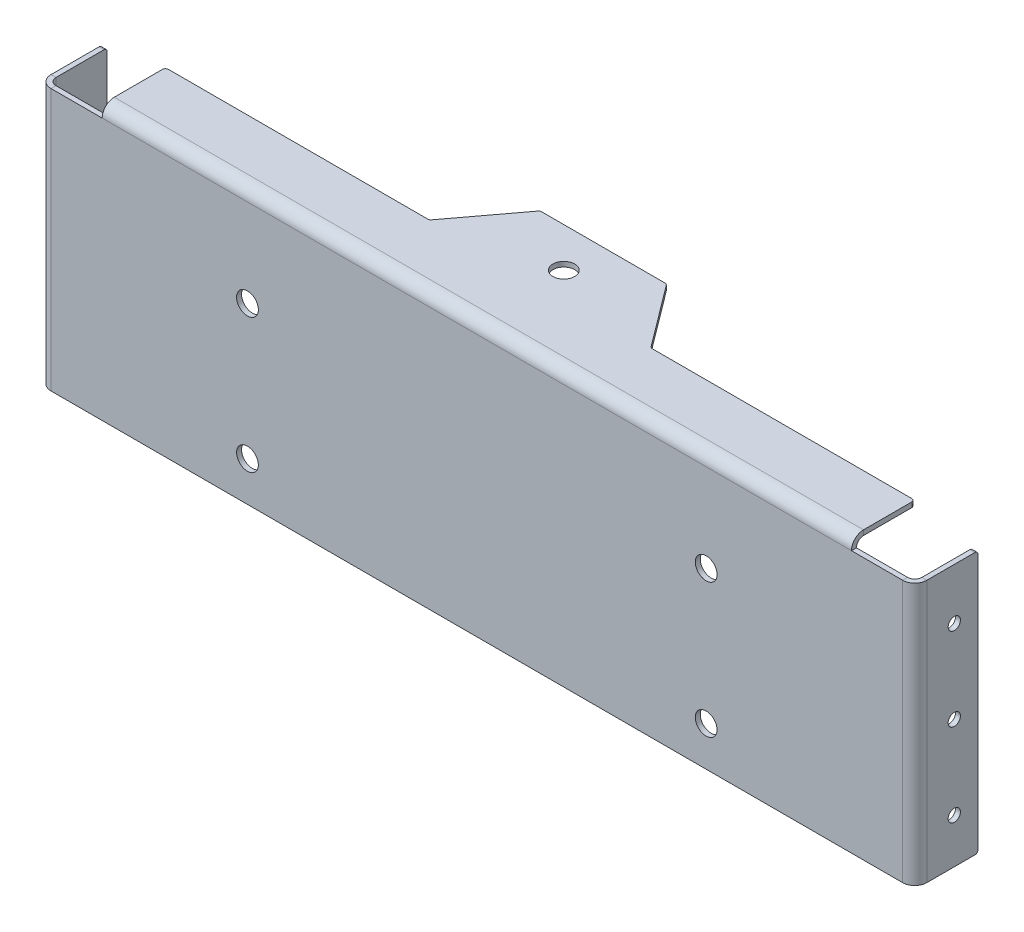
from build123d import *

# Parameters (mm, degrees)
SKETCH1_W                                 = 351.6122
SKETCH1_H                                 = 105.156
BASE_FLANGE1_DEPTH                        = 1.9939
EDGE_FLANGE1_STRIP_W                      = 13.66774
EDGE_FLANGE1_STRIP_H                      = 1.9939
EDGE_FLANGE1_STRIP_CUT_DEPTH              = 105.156
EDGE_FLANGE1_STRIP_2_W                    = 13.66774
EDGE_FLANGE1_STRIP_2_H                    = 1.9939
EDGE_FLANGE1_STRIP_CUT_2_DEPTH            = 105.156
EDGE_FLANGE1_DEPTH                        = 105.156
EDGE_FLANGE1_BEND_DEPTH                   = 105.156
EDGE_FLANGE2_DEPTH                        = 300.8122
EDGE_FLANGE2_START                        = 1.9939
EDGE_FLANGE2_FLAT_DEPTH                   = 1.9939
F_0_221_DIAMETER_HOLE1_D                  = 4.9149
HOLE_FOR_1_4_SELF_CLINCHING_NUTS_S_SS_C_D = 8.7376
HOLE_FOR_1_4_SELF_CLINCHING_NUTS_S_2_D    = 8.7376
FILLET1_R                                 = 1.27


# Sheet-metal steps are written as plain solids
with BuildPart() as part:
    # Sketch1 → Base-Flange1 (new body)
    with BuildSketch(Plane.XY):
        with Locations((175.8061, 52.578)):
            Rectangle(SKETCH1_W, SKETCH1_H)
    extrude(amount=-BASE_FLANGE1_DEPTH)

    # Edge-Flange1 strip (across the edge) → Edge-Flange1 strip cut (cut)
    with BuildSketch(Plane(origin=(0, 0, -1.9939), x_dir=(1, 0, 0), z_dir=(0, 1, 0))):
        with Locations((-1.9939, -0.99695)):
            Rectangle(EDGE_FLANGE1_STRIP_W, EDGE_FLANGE1_STRIP_H)
    extrude(amount=EDGE_FLANGE1_STRIP_CUT_DEPTH, mode=Mode.SUBTRACT)

    # Edge-Flange1 strip 2 (across the edge) → Edge-Flange1 strip cut 2 (cut)
    with BuildSketch(Plane(origin=(351.6122, 105.156, -1.9939), x_dir=(-1, 0, 0), z_dir=(0, -1, 0))):
        with Locations((-1.9939, -0.99695)):
            Rectangle(EDGE_FLANGE1_STRIP_2_W, EDGE_FLANGE1_STRIP_2_H)
    extrude(amount=EDGE_FLANGE1_STRIP_CUT_2_DEPTH, mode=Mode.SUBTRACT)

    # Edge-Flange1 section (across the edge) → Edge-Flange1 (add)
    with BuildSketch(Plane(origin=(0, 0, -1.9939), x_dir=(1, 0, 0), z_dir=(0, 1, 0))):
        with BuildLine():
            Line((0, 2.84607), (0, 23.4061))
            Line((0, 23.4061), (1.9939, 23.4061))
            Line((1.9939, 23.4061), (1.9939, 2.84607))
            ThreePointArc((1.9939, 2.84607), (2.827494603, 0.833594603), (4.83997, 0))
            Line((4.83997, 0), (4.83997, -1.9939))
            ThreePointArc((4.83997, -1.9939), (1.417594392, -0.576305608), (0, 2.84607))
        make_face()
    extrude(amount=EDGE_FLANGE1_DEPTH)

    # Edge-Flange1 section 2 (across the edge) → Edge-Flange1 bend (add)
    with BuildSketch(Plane(origin=(351.6122, 105.156, -1.9939), x_dir=(-1, 0, 0), z_dir=(0, -1, 0))):
        with BuildLine():
            Line((0, 2.84607), (0, 23.4061))
            Line((0, 23.4061), (1.9939, 23.4061))
            Line((1.9939, 23.4061), (1.9939, 2.84607))
            ThreePointArc((1.9939, 2.84607), (2.827494603, 0.833594603), (4.83997, 0))
            Line((4.83997, 0), (4.83997, -1.9939))
            ThreePointArc((4.83997, -1.9939), (1.417594392, -0.576305608), (0, 2.84607))
        make_face()
    extrude(amount=EDGE_FLANGE1_BEND_DEPTH)

    # Edge-Flange2 bend section (across the edge) → Edge-Flange2 (add)
    with BuildSketch(Plane(origin=(25.4, 108.00207, -1.9939), x_dir=(0, -1, 0), z_dir=(1, 0, 0))):
        with BuildLine():
            Line((-1.9939, 2.84607), (0, 2.84607))
            ThreePointArc((0, 2.84607), (0.833594603, 0.833594603), (2.84607, 0))
            Line((2.84607, 0), (2.84607, -1.9939))
            ThreePointArc((2.84607, -1.9939), (-0.576305608, -0.576305608), (-1.9939, 2.84607))
        make_face()
    extrude(amount=EDGE_FLANGE2_DEPTH)

    # Edge-Flange2 profile (on flange) → Edge-Flange2 flat (add)
    with BuildSketch(Plane(origin=(0, 108.00207, -1.9939), x_dir=(1, 0, 0), z_dir=(0, 1, 0)).offset(EDGE_FLANGE2_START)):
        Polygon((326.2122, 2.84607), (326.2122, 23.4061), (220.2561, 23.4061), (201.2061, 48.8061), (150.4061, 48.8061), (131.3561, 23.4061), (25.4, 23.4061), (25.4, 2.84607), align=None)
    extrude(amount=-EDGE_FLANGE2_FLAT_DEPTH)

    # 0.221_ Diameter Hole1 (through all)
    with Locations(Plane(origin=(351.6122, 0, 0), x_dir=(0, 0, -1), z_dir=(1, 0, 0))):
        with Locations((15.875, 84.59597), (15.875, 17.92097), (15.875, 51.25847)):
            Hole(F_0_221_DIAMETER_HOLE1_D / 2)

    # Hole for 1_4 Self-clinching Nuts _S_SS_C (through all)
    with Locations(Plane(origin=(0, 109.99597, 0), x_dir=(1, 0, 0), z_dir=(0, 1, 0))):
        with Locations((175.8061, 34.925)):
            Hole(HOLE_FOR_1_4_SELF_CLINCHING_NUTS_S_SS_C_D / 2)

    # Hole for 1_4 Self-clinching Nuts _S_ 2 (through all)
    with Locations(Plane.XY):
        with Locations((83.7311, 69.86397), (83.7311, 15.88897), (267.8811, 15.88897), (267.8811, 69.86397)):
            Hole(HOLE_FOR_1_4_SELF_CLINCHING_NUTS_S_2_D / 2)

    # Fillet1
    fillet1_edges = [part.edges().sort_by_distance(p)[0] for p in [
        (0.99695, 0, -25.4),
        (0.99695, 105.156, -25.4),
        (350.61525, 105.156, -25.4),
        (350.61525, 0, -25.4),
        (25.4, 108.99902, -25.4),
        (326.2122, 108.99902, -25.4),
        (220.2561, 108.99902, -25.4),
        (201.2061, 108.99902, -50.8),
        (150.4061, 108.99902, -50.8),
        (131.3561, 108.99902, -25.4),
    ]]
    fillet(fillet1_edges, radius=FILLET1_R)


solid = part.part
